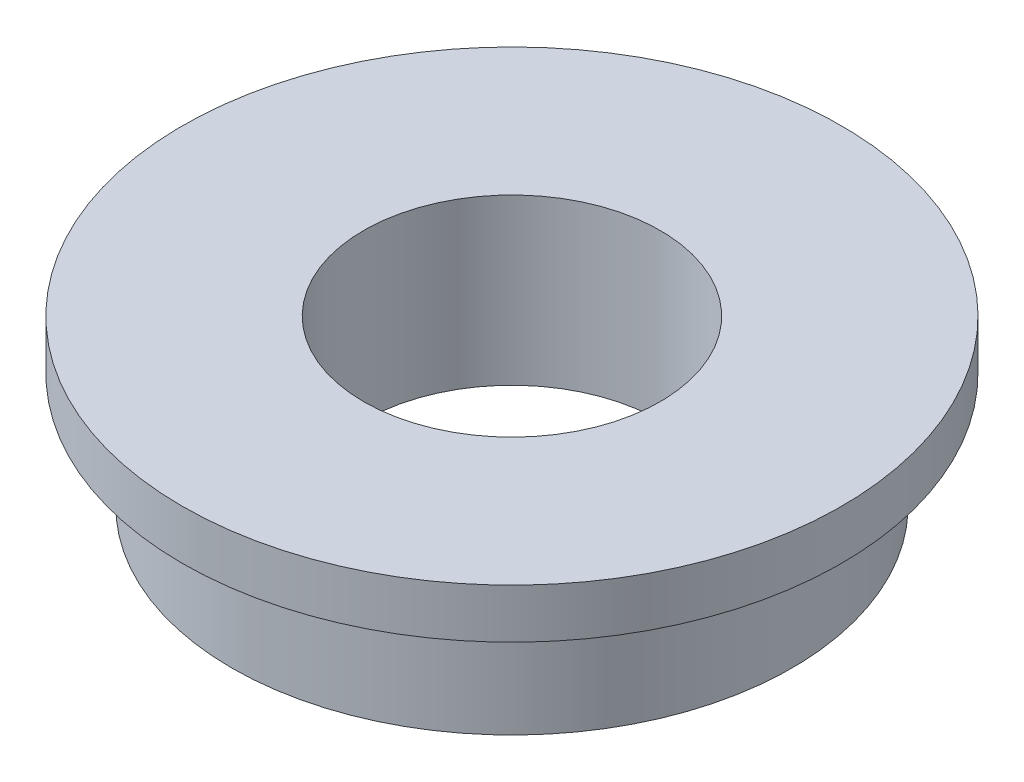
from build123d import *

# Parameters (mm, degrees)
SKETCH2_R           = 8.5
SKETCH2_R_2         = 4.5
BOSS_EXTRUDE1_DEPTH = 5
BOSS_EXTRUDE2_START = -1.5
SKETCH3_R           = 10
SKETCH3_R_2         = 8.5
BOSS_EXTRUDE2_DEPTH = 1.5


with BuildPart() as part:
    # Sketch2 → Boss-Extrude1 (new body)
    with BuildSketch(Plane(origin=(0, 0, 0), x_dir=(1, 0, 0), z_dir=(0, 1, 0))):
        Circle(SKETCH2_R)
        Circle(SKETCH2_R_2, mode=Mode.SUBTRACT)
    extrude(amount=BOSS_EXTRUDE1_DEPTH)

    # Sketch3 → Boss-Extrude2 (add)
    with BuildSketch(Plane(origin=(0, 5, 0), x_dir=(1, 0, 0), z_dir=(0, 1, 0)).offset(BOSS_EXTRUDE2_START)):
        Circle(SKETCH3_R)
        Circle(SKETCH3_R_2, mode=Mode.SUBTRACT)
    extrude(amount=BOSS_EXTRUDE2_DEPTH)


solid = part.part
